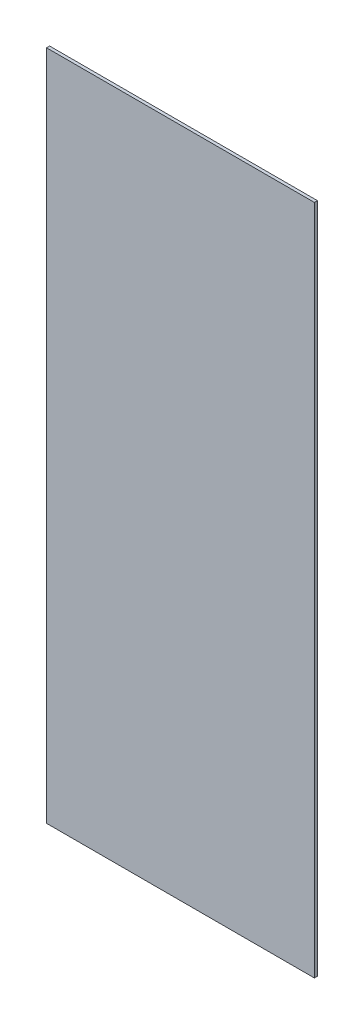
from build123d import *

# Parameters (mm, degrees)
SKETCH_1_W      = 524
SKETCH_1_H      = 1314
EXTRUDE_1_DEPTH = 6


with BuildPart() as part:
    # Эскиз1 → Бобышка-Вытянуть1 (new body)
    with BuildSketch(Plane.XY):
        with Locations((262, -226)):
            Rectangle(SKETCH_1_W, SKETCH_1_H)
    extrude(amount=-EXTRUDE_1_DEPTH)


solid = part.part
